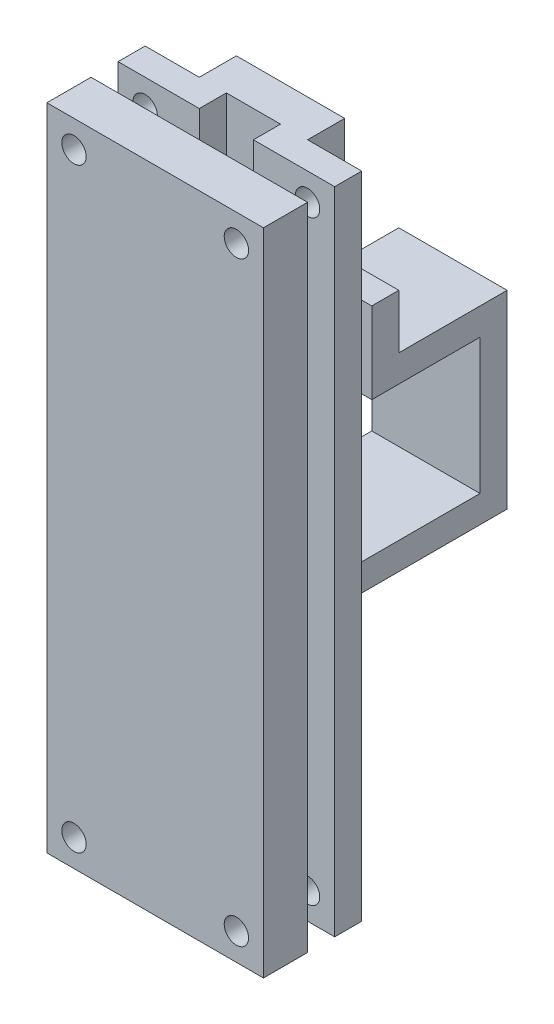
from build123d import *

# Parameters (mm, degrees)
SKETCH1_W                           = 40
SKETCH1_H                           = 8.15
BOSS_EXTRUDE1_DEPTH                 = 120
BOSS_EXTRUDE1_2_DEPTH               = 120
SKETCH3_W                           = 30
SKETCH3_H                           = 42.5
CUT_EXTRUDE2_DEPTH                  = 120
F_4_5_4_5_DIAMETER_HOLE1_AT_2_COUNT = 2
F_4_5_4_5_DIAMETER_HOLE1_AT_2_PITCH = 30
F_4_5_4_5_DIAMETER_HOLE1_AT_3_COUNT = 2
F_4_5_4_5_DIAMETER_HOLE1_AT_3_PITCH = 114.01754251
F_4_5_4_5_DIAMETER_HOLE1_AT_4_COUNT = 2
F_4_5_4_5_DIAMETER_HOLE1_AT_4_PITCH = 110


with BuildPart() as part:
    # Sketch1 → Boss-Extrude1 (new body)
    with BuildSketch(Plane(origin=(0, 0, 0), x_dir=(1, 0, 0), z_dir=(0, 1, 0))):
        with Locations((20, 4.075)):
            Rectangle(SKETCH1_W, SKETCH1_H)
    extrude(amount=BOSS_EXTRUDE1_DEPTH)


with BuildPart() as body_2:
    # Sketch1 → Boss-Extrude1 2 (new body)
    with BuildSketch(Plane(origin=(0, 0, 0), x_dir=(1, 0, 0), z_dir=(0, 1, 0))):
        Polygon((10, 55), (30, 55), (30, 18.15), (40, 18.15), (40, 13.15), (25, 13.15), (25, 18.15), (15, 18.15), (15, 13.15), (0, 13.15), (0, 18.15), (10, 18.15), align=None)
    extrude(amount=BOSS_EXTRUDE1_2_DEPTH)

    # Sketch3 → Cut-Extrude2 (cut)
    with BuildSketch(Plane(origin=(30, 0, 0), x_dir=(0, 0, -1), z_dir=(1, 0, 0))):
        Polygon((25, 120), (55, 120), (55, 77.5), (35, 77.5), (35, 87.5), (30, 87.5), (30, 72.5), (50, 72.5), (50, 47.5), (25, 47.5), (25, 72.5), (25, 77.5), align=None)
        with Locations((40, 21.25)):
            Rectangle(SKETCH3_W, SKETCH3_H)
    extrude(amount=-CUT_EXTRUDE2_DEPTH, mode=Mode.SUBTRACT)


with BuildPart() as f_4_5_4_5_diameter_hole1_tool:
    # Sketch5 → Ø4.5 (4.5) Diameter Hole1 (revolve)
    with BuildSketch(Plane(origin=(35, 5, -18.15), x_dir=(0, 1, 0), z_dir=(1, 0, 0))):
        Polygon((0, 0), (0, 18.15), (2.25, 18.15), (2.25, 0.025), (2.275, 0), align=None)
    f_4_5_4_5_diameter_hole1 = revolve(axis=Axis((35, 5, -24.5), (0, 0, 1)))


with BuildPart() as part_1:
    add(part.part)

    # Ø4.5 (4.5) Diameter Hole1: cut by f_4_5_4_5_diameter_hole1_tool
    add(f_4_5_4_5_diameter_hole1_tool.part, mode=Mode.SUBTRACT)


with BuildPart() as body_2_1:
    add(body_2.part)

    # Ø4.5 (4.5) Diameter Hole1: cut by f_4_5_4_5_diameter_hole1_tool
    add(f_4_5_4_5_diameter_hole1_tool.part, mode=Mode.SUBTRACT)


with BuildPart() as f_4_5_4_5_diameter_hole1_at_2_tool:
    # Ø4.5 (4.5) Diameter Hole1 at 2: Ø4.5 (4.5) Diameter Hole1 ×2
    with Locations(*[(-i * F_4_5_4_5_DIAMETER_HOLE1_AT_2_PITCH, 0, 0) for i in range(1, F_4_5_4_5_DIAMETER_HOLE1_AT_2_COUNT)]):
        add(f_4_5_4_5_diameter_hole1)


with BuildPart() as part_2:
    add(part_1.part)

    # Ø4.5 (4.5) Diameter Hole1 at 2: cut by f_4_5_4_5_diameter_hole1_at_2_tool
    add(f_4_5_4_5_diameter_hole1_at_2_tool.part, mode=Mode.SUBTRACT)


with BuildPart() as body_2_2:
    add(body_2_1.part)

    # Ø4.5 (4.5) Diameter Hole1 at 2: cut by f_4_5_4_5_diameter_hole1_at_2_tool
    add(f_4_5_4_5_diameter_hole1_at_2_tool.part, mode=Mode.SUBTRACT)


with BuildPart() as f_4_5_4_5_diameter_hole1_at_3_tool:
    # Ø4.5 (4.5) Diameter Hole1 at 3: Ø4.5 (4.5) Diameter Hole1 ×2
    with Locations(*[Vector(-0.26311740579210885, 0.9647638212377322, 0) * (i * F_4_5_4_5_DIAMETER_HOLE1_AT_3_PITCH) for i in range(1, F_4_5_4_5_DIAMETER_HOLE1_AT_3_COUNT)]):
        add(f_4_5_4_5_diameter_hole1)


with BuildPart() as part_3:
    add(part_2.part)

    # Ø4.5 (4.5) Diameter Hole1 at 3: cut by f_4_5_4_5_diameter_hole1_at_3_tool
    add(f_4_5_4_5_diameter_hole1_at_3_tool.part, mode=Mode.SUBTRACT)


with BuildPart() as body_2_3:
    add(body_2_2.part)

    # Ø4.5 (4.5) Diameter Hole1 at 3: cut by f_4_5_4_5_diameter_hole1_at_3_tool
    add(f_4_5_4_5_diameter_hole1_at_3_tool.part, mode=Mode.SUBTRACT)


with BuildPart() as f_4_5_4_5_diameter_hole1_at_4_tool:
    # Ø4.5 (4.5) Diameter Hole1 at 4: Ø4.5 (4.5) Diameter Hole1 ×2
    with Locations(*[(0, i * F_4_5_4_5_DIAMETER_HOLE1_AT_4_PITCH, 0) for i in range(1, F_4_5_4_5_DIAMETER_HOLE1_AT_4_COUNT)]):
        add(f_4_5_4_5_diameter_hole1)


with BuildPart() as part_4:
    add(part_3.part)

    # Ø4.5 (4.5) Diameter Hole1 at 4: cut by f_4_5_4_5_diameter_hole1_at_4_tool
    add(f_4_5_4_5_diameter_hole1_at_4_tool.part, mode=Mode.SUBTRACT)


with BuildPart() as body_2_4:
    add(body_2_3.part)

    # Ø4.5 (4.5) Diameter Hole1 at 4: cut by f_4_5_4_5_diameter_hole1_at_4_tool
    add(f_4_5_4_5_diameter_hole1_at_4_tool.part, mode=Mode.SUBTRACT)


solid = Compound([part_4.part, body_2_4.part])
